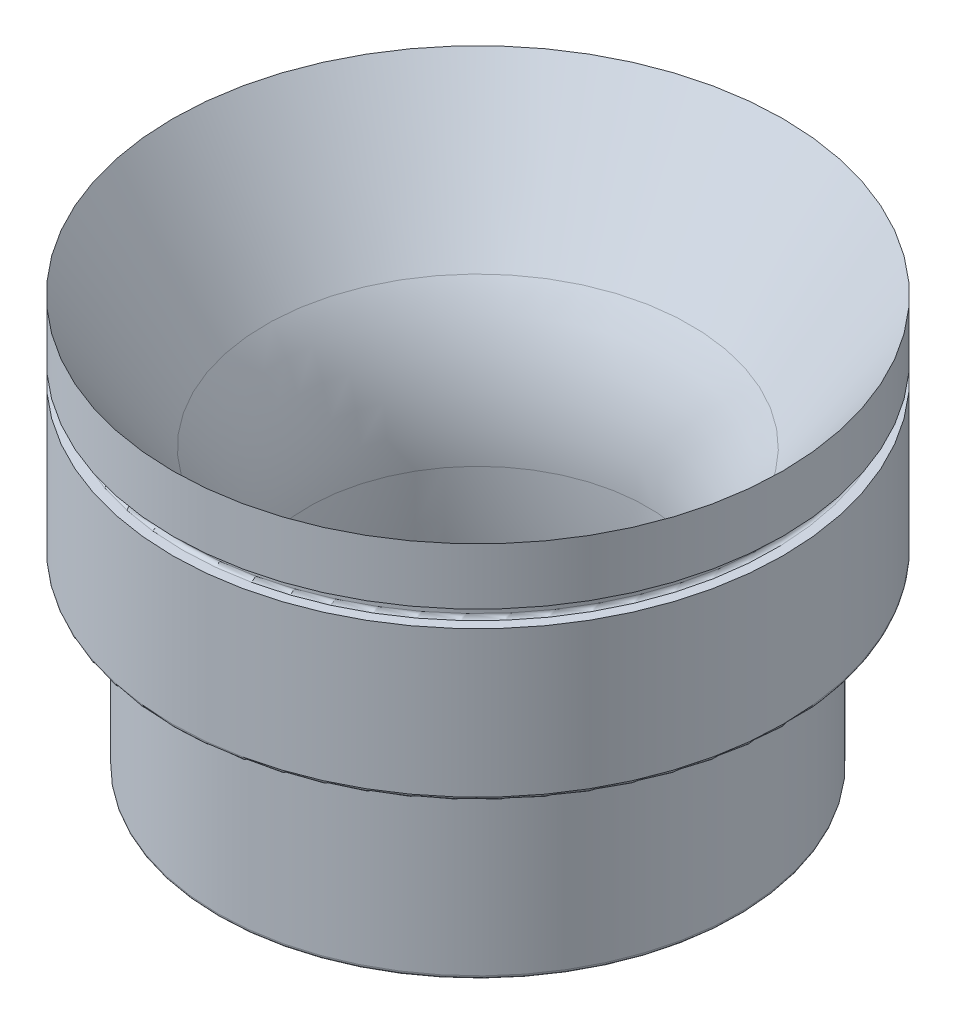
from build123d import *

# Parameters (mm, degrees)
SKETCH6_W     = 1.5113
SKETCH6_H     = 1.905
TOOL_RADIUS_R = 0.4064


with BuildPart() as part:
    # Sketch4 → Revolve1 (revolve)
    with BuildSketch(Plane(origin=(0, 0, 0), x_dir=(0, 0, -1), z_dir=(1, 0, 0))):
        with BuildLine():
            Line((34.2773, 0), (23.873214979, -14.858573285))
            ThreePointArc((23.873214979, -14.858573285), (20.284368924, -22.13603317), (19.05, -30.155856842))
            ThreePointArc((19.05, -30.155856842), (19.383642704, -38.121258134), (20.382233443, -46.030856842))
            Line((20.382233443, -46.030856842), (29.1846, -46.030856842))
            Line((29.1846, -46.030856842), (29.1846, -25.050456842))
            Line((29.1846, -25.050456842), (34.2773, -25.050456842))
            Line((34.2773, -25.050456842), (34.2773, 0))
        make_face()
    revolve(axis=Axis((0, 0, 0), (0, -1, 0)))

    # Sketch6 → Spring Groove (revolve, cut)
    with BuildSketch(Plane(origin=(0, 0, 0), x_dir=(0, 0, -1), z_dir=(1, 0, 0))):
        with Locations((33.52165, -7.3025)):
            Rectangle(SKETCH6_W, SKETCH6_H)
    revolve(axis=Axis((0, 11.364369063, 0), (0, -1, 0)), mode=Mode.SUBTRACT)

    # Tool Radius
    tool_radius_edges = [part.edges().sort_by_distance(p)[0] for p in [
        (0, -46.030856842, 29.1846),
        (0, -25.050456842, 34.2773),
        (0, -6.35, 32.766),
        (0, -8.255, 32.766),
        (0, -25.050456842, 29.1846),
    ]]
    fillet(tool_radius_edges, radius=TOOL_RADIUS_R)


solid = part.part
